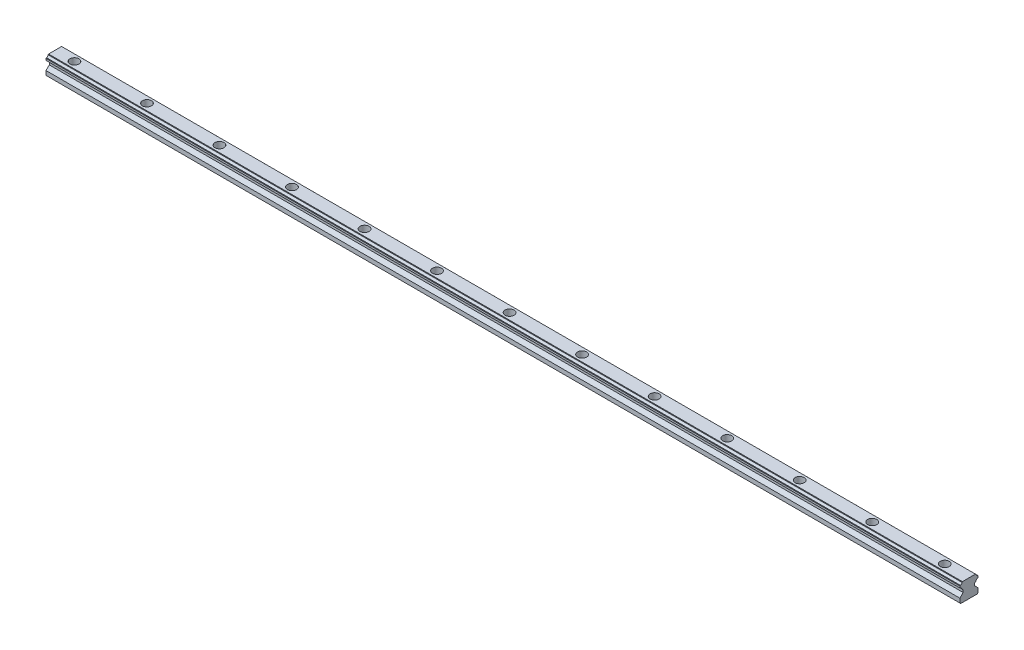
from build123d import *

# Parameters (mm, degrees)
SKETCH1_W                                        = 756
SKETCH1_H                                        = 15
BOSS_EXTRUDE1_DEPTH                              = 15
CUT_EXTRUDE1_DEPTH                               = 757.185989027
CUT_EXTRUDE2_DEPTH                               = 757.185989027
DRAFT1_ANGLE                                     = 45
DRAFT2_ANGLE                                     = 45
HOLE1_D                                          = 3.1199998
CBORE_FOR_M4_HEX_HEAD_MACHINE_SCREW1_D           = 4.5
CBORE_FOR_M4_HEX_HEAD_MACHINE_SCREW1_CBORE_D     = 7.5
CBORE_FOR_M4_HEX_HEAD_MACHINE_SCREW1_CBORE_DEPTH = 5.3
CHAMFER1_SIZE                                    = 0.359114068
CHAMFER2_SIZE                                    = 0.351583128
CHAMFER2_SIZE_2                                  = 0.314005893
CHAMFER3_SIZE                                    = 0.348386014
CHAMFER4_SIZE                                    = 0.699992786
CHAMFER4_SIZE2                                   = 0.69999271
CHAMFER5_SIZE                                    = 0.69999271
CHAMFER5_SIZE2                                   = 0.699992786


with BuildPart() as part:
    # Sketch1 → Boss-Extrude1 (new body)
    with BuildSketch(Plane(origin=(0, 15, 0), x_dir=(-1, 0, 0), z_dir=(0, 1, 0))):
        with Locations((238, 0)):
            Rectangle(SKETCH1_W, SKETCH1_H)
    extrude(amount=-BOSS_EXTRUDE1_DEPTH)

    # Sketch2 → Cut-Extrude1 (cut, through all)
    with BuildSketch(Plane.ZY.offset(616)):
        with BuildLine():
            Line((-7.5, 11.135189072), (-7.5, 4.2000246))
            Line((-7.5, 4.2000246), (-4.8000183, 4.2000246))
            Line((-4.8000183, 4.2000246), (-4.8000183, 8.8400054))
            Line((-4.8000183, 8.8400054), (-5.754192018, 9.794179118))
            ThreePointArc((-5.754192018, 9.794179118), (-6.350212567, 10.82514773), (-7.5, 11.135189072))
        make_face()
    extrude(amount=-CUT_EXTRUDE1_DEPTH, mode=Mode.SUBTRACT)

    # Sketch3 → Cut-Extrude2 (cut, through all)
    with BuildSketch(Plane.ZY.offset(616)):
        with BuildLine():
            Line((7.5, 4.2000246), (7.5, 11.135189072))
            ThreePointArc((7.5, 11.135189072), (6.350212567, 10.82514773), (5.754192018, 9.794179118))
            Line((5.754192018, 9.794179118), (4.8000183, 8.8400054))
            Line((4.8000183, 8.8400054), (4.8000183, 4.2000246))
            Line((4.8000183, 4.2000246), (7.5, 4.2000246))
        make_face()
    extrude(amount=-CUT_EXTRUDE2_DEPTH, mode=Mode.SUBTRACT)

    # Draft1
    draft1_faces = [part.faces().sort_by_distance(p)[0] for p in [
        (-238, 4.2000246, -6.15000915),
    ]]
    draft(draft1_faces, Plane(origin=(140, 0, -7.5), x_dir=(-1, 0, 0), z_dir=(0, 0, -1)), DRAFT1_ANGLE)

    # Draft2
    draft2_faces = [part.faces().sort_by_distance(p)[0] for p in [
        (-238, 4.2000246, 6.15000915),
    ]]
    draft(draft2_faces, Plane(origin=(-616, 0, 7.5), x_dir=(1, 0, 0), z_dir=(0, 0, 1)), DRAFT2_ANGLE)

    # Hole1 (through all)
    with Locations(Plane.ZY.offset(616)):
        with Locations((-7.3005066, 14.813004), (7.3005066, 14.813004)):
            Hole(HOLE1_D / 2)

    # CBORE for M4 Hex Head Machine Screw1 (through all)
    with Locations(Plane(origin=(0, 15, 0), x_dir=(-1, 0, 0), z_dir=(0, 1, 0))):
        with Locations((-60, 0), (-120, 0), (0, 0), (60, 0), (120, 0), (180, 0), (240, 0), (300, 0), (360, 0), (420, 0), (480, 0), (540, 0), (600, 0)):
            CounterBoreHole(CBORE_FOR_M4_HEX_HEAD_MACHINE_SCREW1_D / 2, CBORE_FOR_M4_HEX_HEAD_MACHINE_SCREW1_CBORE_D / 2, CBORE_FOR_M4_HEX_HEAD_MACHINE_SCREW1_CBORE_DEPTH)

    # Chamfer1
    # the kernel refuses this chamfer: 0.359114068, 0.320732608 mm, written as the material it takes off along each edge
    with BuildSketch(Plane(origin=(-616.923527515, 13.265812328, 7.5), x_dir=(0, -1, 0), z_dir=(1, 0, 0))) as chamfer1_piece_1:
        with BuildLine():
            Line((CHAMFER1_SIZE * 0.99999999892, 0), (0.005140565, 0.353974179))
            ThreePointArc((0.005140565, 0.353974179), (0.01270895, 0.181894047), (0, 0))
            Line((0, 0), (CHAMFER1_SIZE * 0.99999999892, 0))
        make_face()
    extrude(amount=757.84705503, mode=Mode.SUBTRACT)
    with BuildSketch(Plane(origin=(-616.923527515, 13.265812328, -7.5), x_dir=(0, -0.014520899519340609, 0.9998945661804294), z_dir=(1, 0, 0))) as chamfer1_piece_2:
        with BuildLine():
            Line((0.354011504, 0), (CHAMFER1_SIZE * 0.0145208995037, CHAMFER1_SIZE * 0.999894565101))
            Line((CHAMFER1_SIZE * 0.0145208995037, CHAMFER1_SIZE * 0.999894565101), (0, 0))
            ThreePointArc((0, 0), (0.182059415, 0.010066344), (0.354011504, 0))
        make_face()
    extrude(amount=757.84705503, mode=Mode.SUBTRACT)

    # Chamfer2
    # the kernel refuses this chamfer: 0.351583128, 0.314005893 mm, written as the material it takes off along each edge
    with BuildSketch(Plane(origin=(-616.904160355, 11.135189072, -7.5), x_dir=(0, 0.017205827635516736, 0.9998519687910691), z_dir=(1, 0, 0))) as chamfer2_piece_1:
        with BuildLine():
            Line((0.345686311, 0), (CHAMFER2_SIZE * 0.0172058276427, -CHAMFER2_SIZE * 0.999851969207))
            Line((CHAMFER2_SIZE * 0.0172058276427, -CHAMFER2_SIZE * 0.999851969207), (0, 0))
            ThreePointArc((0, 0), (0.177775336, -0.009597014), (0.345686311, 0))
        make_face()
    extrude(amount=757.808320711, mode=Mode.SUBTRACT)
    with BuildSketch(Plane(origin=(-617.049666566, 11.135189072, 7.5), x_dir=(0, 1, 0), z_dir=(1, 0, 0))) as chamfer2_piece_2:
        with BuildLine():
            Line((CHAMFER2_SIZE_2 * 0.999999998673, 0), (-0.001272129, -0.408616458))
            ThreePointArc((-0.001272129, -0.408616458), (0.012772883, -0.209994562), (0, 0))
            Line((0, 0), (CHAMFER2_SIZE_2 * 0.999999998673, 0))
        make_face()
    extrude(amount=758.099333132, mode=Mode.SUBTRACT)

    # Chamfer3
    # the kernel refuses this chamfer: 0.348386014, 0.313117398 mm, written as the material it takes off along each edge
    with BuildSketch(Plane(origin=(-616.895938121, 15, 5.751754785), x_dir=(0, 0, -1), z_dir=(1, 0, 0))) as chamfer3_piece_1:
        with BuildLine():
            Line((CHAMFER3_SIZE, 0), (0.003206731, -0.345186893))
            ThreePointArc((0.003206731, -0.345186893), (0.011218763, -0.177431259), (0, 0))
            Line((0, 0), (CHAMFER3_SIZE, 0))
        make_face()
    extrude(amount=757.791876243, mode=Mode.SUBTRACT)
    with BuildSketch(Plane(origin=(-616.895938121, 15, -5.751754785), x_dir=(0, 0, 1), z_dir=(1, 0, 0))) as chamfer3_piece_2:
        with BuildLine():
            Line((CHAMFER3_SIZE, 0), (0.003206731, 0.345186893))
            ThreePointArc((0.003206731, 0.345186893), (0.011218763, 0.177431259), (0, 0))
            Line((0, 0), (CHAMFER3_SIZE, 0))
        make_face()
    extrude(amount=757.791876243, mode=Mode.SUBTRACT)

    # Chamfer4
    chamfer4_edges = [part.edges().sort_by_distance(p)[0] for p in [
        (-238, 0, 7.5),
    ]]
    chamfer4_side = [part.faces().sort_by_distance(p)[0] for p in [
        (-238, 2.1000123, 7.5),
    ]]
    chamfer(chamfer4_edges, length=CHAMFER4_SIZE, length2=CHAMFER4_SIZE2, reference=chamfer4_side[0])

    # Chamfer5
    chamfer5_edges = [part.edges().sort_by_distance(p)[0] for p in [
        (-238, 0, -7.5),
    ]]
    chamfer5_side = [part.faces().sort_by_distance(p)[0] for p in [
        (-608.438647672, 0, -0.349996355),
    ]]
    chamfer(chamfer5_edges, length=CHAMFER5_SIZE, length2=CHAMFER5_SIZE2, reference=chamfer5_side[0])


solid = part.part
